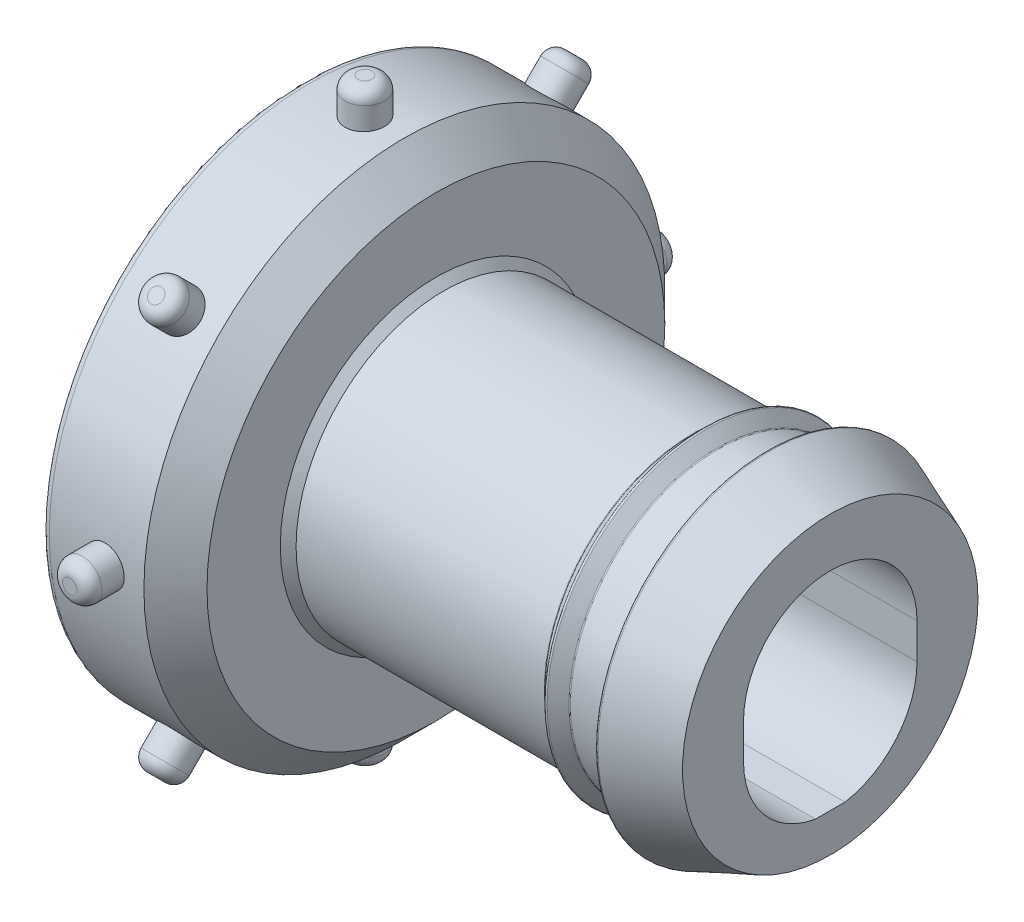
from build123d import *

# Parameters (mm, degrees)
SKETCH2_R                = 16.51
SKETCH2_R_2              = 9.365
SKETCH2_R_3              = 6.5
BOSS_EXTRUDE1_DEPTH      = 8.5
SKETCH4_W                = 18.18
SKETCH4_H                = 13.55
CUT_EXTRUDE1_DEPTH       = 7
SKETCH6_R                = 0.9
FILLET1_R                = 1
BOSS_EXTRUDE2_START      = -2
SKETCH7_R                = 1.25
BOSS_EXTRUDE2_DEPTH      = 4.2
FILLET2_R                = 0.8
CIRPATTERN1_COUNT        = 8
FILLET2_OF_CIRPATTERN1_R = 0.8
CHAMFER1_SIZE            = 2
FILLET3_R                = 0.5
FILLET4_R                = 0.1
CHAMFER2_SIZE            = 0.5
CUT_EXTRUDE2_DEPTH       = 37.402310366
CUT_EXTRUDE2_DEPTH_BACK  = 37.402310366
SKETCH2_3_R              = 6.5
CHAMFER3_SIZE            = 1
CHAMFER3_SIZE2           = 4.010780934
SKETCH8_W                = 2.59
SKETCH8_H                = 7.65
BOSS_EXTRUDE3_DEPTH      = 0.64
FILLET5_R                = 0.5
SKETCH9_R                = 9.365
BOSS_EXTRUDE4_DEPTH      = 26.5
CUT_EXTRUDE3_DEPTH       = 38.448340417
CHAMFER4_SIZE            = 3


with BuildPart() as part:
    # Sketch1 → Revolve1 (revolve)
    with BuildSketch(Plane(origin=(0, 0, 0), x_dir=(1, 0, 0), z_dir=(0, 1, 0))):
        Polygon((0, 0), (-25, 0), (-25, 9.365), (-8.73, 9.365), (-7.94, 10.155), (-7.15, 9.365), (-3.97, 9.365), (-3.97, 10.955), (0, 9.365), align=None)
    revolve(axis=Axis((0, 0, 0), (-1, 0, 0)))

    # Sketch2 → Boss-Extrude1 (add)
    # profile 1 of 2: a face of its own
    with BuildSketch(Plane.ZY.offset(25)):
        Circle(SKETCH2_R)
        with Locations(Location((0, 0, 0), (0, 0, 180))):
            Circle(SKETCH2_R_2, mode=Mode.SUBTRACT)
    # profile 2 of 2: a face of its own
    with BuildSketch(Plane.ZY.offset(25)):
        with Locations(Location((0, 0, 0), (0, 0, 180))):
            Circle(SKETCH2_R_2)
        Circle(SKETCH2_R_3, mode=Mode.SUBTRACT)
    extrude(amount=BOSS_EXTRUDE1_DEPTH)

    # Sketch4 → Cut-Extrude1 (cut)
    with BuildSketch(Plane.ZY.offset(33.5)):
        with Locations((0, -0.145)):
            Rectangle(SKETCH4_W, SKETCH4_H)
    extrude(amount=-CUT_EXTRUDE1_DEPTH, mode=Mode.SUBTRACT)

    # Sketch6 → Cut-Revolve1 (revolve, cut)
    with BuildSketch(Plane.XY, mode=Mode.PRIVATE) as cut_revolve1_sk:
        with Locations((-33.5, 14.14)):
            Circle(SKETCH6_R)
    revolve(cut_revolve1_sk.sketch.rotate(Axis((-35.027065124, 0, 0), (1, 0, 0)), 90), axis=Axis((-35.027065124, 0, 0), (1, 0, 0)), mode=Mode.SUBTRACT)

    # Fillet1
    fillet1_edges = [part.edges().sort_by_distance(p)[0] for p in [
        (-33.5, 0, -13.24),
    ]]
    fillet(fillet1_edges, radius=FILLET1_R)

    # Sketch7 → Boss-Extrude2 (add)
    with BuildSketch(Plane(origin=(0, 16.51, 0), x_dir=(1, 0, 0), z_dir=(0, 1, 0)).offset(BOSS_EXTRUDE2_START)):
        with Locations(Location((-29.5, 0, 0), (0, 0, 270))):
            Circle(SKETCH7_R)
    boss_extrude2 = extrude(amount=BOSS_EXTRUDE2_DEPTH)

    # Fillet2
    fillet2_edges = [part.edges().sort_by_distance(p)[0] for p in [
        (-29.5, 18.71, -1.25),
    ]]
    fillet(fillet2_edges, radius=FILLET2_R)

    # CirPattern1: Boss-Extrude2 ×8 about axis
    cirpattern1_axis = Axis((0, 0, 0), (1, 0, 0))
    for i in range(1, CIRPATTERN1_COUNT):
        add(boss_extrude2.rotate(cirpattern1_axis, i * 360 / CIRPATTERN1_COUNT))

    # Fillet2 of CirPattern1
    fillet2_of_cirpattern1_edges = [part.edges().sort_by_distance(p)[0] for p in [
        (-29.5, 14.113851352, 12.3460844),
        (-29.5, 1.25, 18.71),
        (-29.5, -12.3460844, 14.113851352),
        (-29.5, -18.71, 1.25),
        (-29.5, -14.113851352, -12.3460844),
        (-29.5, -1.25, -18.71),
        (-29.5, 12.3460844, -14.113851352),
    ]]
    fillet(fillet2_of_cirpattern1_edges, radius=FILLET2_OF_CIRPATTERN1_R)

    # Chamfer1
    chamfer1_edges = [part.edges().sort_by_distance(p)[0] for p in [
        (-25, 0, -16.51),
    ]]
    chamfer(chamfer1_edges, length=CHAMFER1_SIZE)

    # Fillet3
    fillet3_edges = [part.edges().sort_by_distance(p)[0] for p in [
        (-33.5, 0, -16.51),
    ]]
    fillet(fillet3_edges, radius=FILLET3_R)

    # Fillet4
    fillet4_edges = [part.edges().sort_by_distance(p)[0] for p in [
        (-3.97, 0, 9.365),
        (-3.97, 0, 10.955),
        (-8.73, 0, 9.365),
        (-7.94, 0, 10.155),
        (-7.15, 0, 9.365),
    ]]
    fillet(fillet4_edges, radius=FILLET4_R)

    # Chamfer2
    chamfer2_edges = [part.edges().sort_by_distance(p)[0] for p in [
        (-25, 0, 9.365),
    ]]
    chamfer(chamfer2_edges, length=CHAMFER2_SIZE)

    # Sketch2<3> → Cut-Extrude2 (cut, two sides: drawn at the far end of the back side and taken through both)
    with BuildSketch(Plane.ZY.offset(25).offset(-CUT_EXTRUDE2_DEPTH_BACK)):
        with Locations(Location((0, 0, 0), (0, 0, 180))):
            Circle(SKETCH2_3_R)
    extrude(amount=CUT_EXTRUDE2_DEPTH + CUT_EXTRUDE2_DEPTH_BACK, mode=Mode.SUBTRACT)

    # Chamfer3
    chamfer3_edges = [part.edges().sort_by_distance(p)[0] for p in [
        (-33.5, -6.92, 0),
    ]]
    chamfer3_side = [part.faces().sort_by_distance(p)[0] for p in [
        (-33.5, 0, -12.170205593),
    ]]
    chamfer(chamfer3_edges, length=CHAMFER3_SIZE, length2=CHAMFER3_SIZE2, reference=chamfer3_side[0])

    # Sketch8 → Boss-Extrude3 (add)
    with BuildSketch(Plane.ZY.offset(26.5)):
        with Locations((-7.795, -3.095)):
            Rectangle(SKETCH8_W, SKETCH8_H)
    extrude(amount=BOSS_EXTRUDE3_DEPTH)

    # Fillet5
    fillet5_edges = [part.edges().sort_by_distance(p)[0] for p in [
        (-27.14, -3.095, -6.5),
        (-27.14, 0.73, -7.795),
    ]]
    fillet(fillet5_edges, radius=FILLET5_R)

    # Sketch9 → Boss-Extrude4 (add)
    with BuildSketch(Plane(origin=(0, 0, 0), x_dir=(0, 0, -1), z_dir=(1, 0, 0))):
        Circle(SKETCH9_R)
    extrude(amount=-BOSS_EXTRUDE4_DEPTH)

    # Sketch10 → Cut-Extrude3 (cut, through all)
    with BuildSketch(Plane.ZY.offset(26.5)):
        with BuildLine():
            ThreePointArc((-5.383713867, -0.375), (-0.193085417, 3.996609684), (5.291502622, 0))
            Line((5.291502622, 0), (5.448623679, 0))
            ThreePointArc((5.448623679, 0), (5.487140887, 0.374121188), (5.5, 0.75))
            ThreePointArc((5.5, 0.75), (0, 6.25), (-5.5, 0.75))
            ThreePointArc((-5.5, 0.75), (-5.470851226, 0.184502992), (-5.383713867, -0.375))
        make_face()
        with BuildLine():
            Line((5.448623679, 0), (5.291502622, 0))
            ThreePointArc((5.291502622, 0), (5.340900488, -0.186690448), (5.383713867, -0.375))
            ThreePointArc((5.383713867, -0.375), (5.419413292, -0.188061603), (5.448623679, 0))
        make_face()
        with BuildLine():
            ThreePointArc((5.383713867, -0.375), (5.340900488, -0.186690448), (5.291502622, 0))
            ThreePointArc((5.291502622, 0), (-0.193085417, 3.996609684), (-5.383713867, -0.375))
            ThreePointArc((-5.383713867, -0.375), (0, -4.75), (5.383713867, -0.375))
        make_face()
        with BuildLine():
            ThreePointArc((5.5, -1.5), (5.470851226, -0.934502992), (5.383713867, -0.375))
            ThreePointArc((5.383713867, -0.375), (0, -4.75), (-5.383713867, -0.375))
            ThreePointArc((-5.383713867, -0.375), (-5.470851226, -0.934502992), (-5.5, -1.5))
            ThreePointArc((-5.5, -1.5), (-4.206581833, -5.043256875), (-0.934665716, -6.92))
            Line((-0.934665716, -6.92), (0.934665716, -6.92))
            ThreePointArc((0.934665716, -6.92), (4.206581833, -5.043256875), (5.5, -1.5))
        make_face()
        with BuildLine():
            Line((5.5, 0), (5.448623679, 0))
            ThreePointArc((5.448623679, 0), (5.419413292, -0.188061603), (5.383713867, -0.375))
            ThreePointArc((5.383713867, -0.375), (5.470851226, -0.934502992), (5.5, -1.5))
            Line((5.5, -1.5), (5.5, 0))
        make_face()
        with BuildLine():
            ThreePointArc((5.5, 0.75), (5.487140887, 0.374121188), (5.448623679, 0))
            Line((5.448623679, 0), (5.5, 0))
            Line((5.5, 0), (5.5, 0.75))
        make_face()
        with BuildLine():
            ThreePointArc((-5.5, -1.5), (-5.470851226, -0.934502992), (-5.383713867, -0.375))
            ThreePointArc((-5.383713867, -0.375), (-5.470851226, 0.184502992), (-5.5, 0.75))
            Line((-5.5, 0.75), (-5.5, -1.5))
        make_face()
    extrude(amount=-CUT_EXTRUDE3_DEPTH, mode=Mode.SUBTRACT)

    # Chamfer4
    # the kernel refuses this chamfer: 3 mm, written as the material it takes off along each edge
    with BuildSketch(Plane(origin=(-26.5, -1.5, 0), x_dir=(0, -0.33195990083986143, 0.9432934984586661), z_dir=(0, 0.9432934984586661, 0.33195990083986143))) as chamfer4_piece_1_section:
        Polygon((5.5 + CHAMFER4_SIZE, 0), (5.5, CHAMFER4_SIZE), (5.5, 0), align=None)
    chamfer4_piece_1 = revolve(axis=Axis((-26.5, -1.5, 0), (1, 0, 0)), revolution_arc=160.612223261, mode=Mode.PRIVATE)
    chamfer4_piece_1 = split(chamfer4_piece_1, bisect_by=Plane(origin=(-25.447070523, -5.452656948, -6.5), z_dir=(0, 0, 1)), keep=Keep.TOP, mode=Mode.PRIVATE)
    chamfer4_piece_1 = split(chamfer4_piece_1, bisect_by=Plane(origin=(-25.447070523, -6.92, 4.818402708), z_dir=(0, 1, 0)), keep=Keep.TOP, mode=Mode.PRIVATE)
    add(chamfer4_piece_1, mode=Mode.SUBTRACT)
    with BuildSketch(Plane(origin=(-26.5, 0.75, 0), x_dir=(0, 0, 1), z_dir=(0, -1, 0))) as chamfer4_piece_2_section:
        Polygon((5.5 + CHAMFER4_SIZE, 0), (5.5, -CHAMFER4_SIZE), (5.5, 0), align=None)
    chamfer4_piece_2 = revolve(axis=Axis((-26.5, 0.75, 0), (-1, 0, 0)), revolution_arc=180, mode=Mode.PRIVATE)
    chamfer4_piece_2 = split(chamfer4_piece_2, bisect_by=Plane(origin=(-25.662102139, 6.63, 6.378806092), z_dir=(0, -1, 0)), keep=Keep.TOP, mode=Mode.PRIVATE)
    add(chamfer4_piece_2, mode=Mode.SUBTRACT)
    with BuildSketch(Plane(origin=(-26.5, -1.5, 0), x_dir=(0, 0, 1), z_dir=(0, 1, 0))) as chamfer4_piece_3_section:
        Polygon((5.5 + CHAMFER4_SIZE, 0), (5.5, CHAMFER4_SIZE), (5.5, 0), align=None)
    chamfer4_piece_3 = revolve(axis=Axis((-26.5, -1.5, 0), (1, 0, 0)), revolution_arc=160.612223261, mode=Mode.PRIVATE)
    chamfer4_piece_3 = split(chamfer4_piece_3, bisect_by=Plane(origin=(-25.657091306, -3.490113714, -6.5), z_dir=(0, 0, 1)), keep=Keep.TOP, mode=Mode.PRIVATE)
    chamfer4_piece_3 = split(chamfer4_piece_3, bisect_by=Plane(origin=(-25.657091306, -6.92, 6.383499273), z_dir=(0, 1, 0)), keep=Keep.TOP, mode=Mode.PRIVATE)
    add(chamfer4_piece_3, mode=Mode.SUBTRACT)
    with BuildSketch(Plane(origin=(-26.5, 0.75, -5.5), x_dir=(-0.02749587661058564, 0, -0.9996219169112968), z_dir=(0, -1, 0))) as chamfer4_piece_4_section:
        Polygon((CHAMFER4_SIZE * 0.999621916911, CHAMFER4_SIZE * 0.0274958766106), (-CHAMFER4_SIZE * 0.0274958766106, CHAMFER4_SIZE * 0.999621916911), (0, 0), align=None)
    chamfer4_piece_4 = extrude(amount=2.25, mode=Mode.PRIVATE)
    chamfer4_piece_4 = split(chamfer4_piece_4, bisect_by=Plane(origin=(-25.833333333, 0.73, -7.166666667), z_dir=(0, 1, 0)), keep=Keep.TOP, mode=Mode.PRIVATE)
    add(chamfer4_piece_4, mode=Mode.SUBTRACT)
    with BuildSketch(Plane(origin=(-26.5, 0.75, -5.5), x_dir=(-0.02749587661058564, 0, -0.9996219169112968), z_dir=(0, -1, 0))) as chamfer4_piece_5_section:
        Polygon((CHAMFER4_SIZE * 0.999621916911, CHAMFER4_SIZE * 0.0274958766106), (-CHAMFER4_SIZE * 0.0274958766106, CHAMFER4_SIZE * 0.999621916911), (0, 0), align=None)
    chamfer4_piece_5 = extrude(amount=2.25, mode=Mode.PRIVATE)
    chamfer4_piece_5 = split(chamfer4_piece_5, bisect_by=Plane(origin=(-25.233333333, -0.385, -6.5), z_dir=(0, 0, 1)), keep=Keep.TOP, mode=Mode.PRIVATE)
    add(chamfer4_piece_5, mode=Mode.SUBTRACT)
    with BuildSketch(Plane(origin=(-26.5, 0.75, 5.5), x_dir=(-0.027495876610585623, 0, 0.9996219169112968), z_dir=(0, -1, 0))) as chamfer4_piece_6:
        Polygon((CHAMFER4_SIZE * 0.999621916911, -CHAMFER4_SIZE * 0.0274958766106), (-CHAMFER4_SIZE * 0.0274958766106, -CHAMFER4_SIZE * 0.999621916911), (0, 0), align=None)
    extrude(amount=2.25, mode=Mode.SUBTRACT)


solid = part.part
